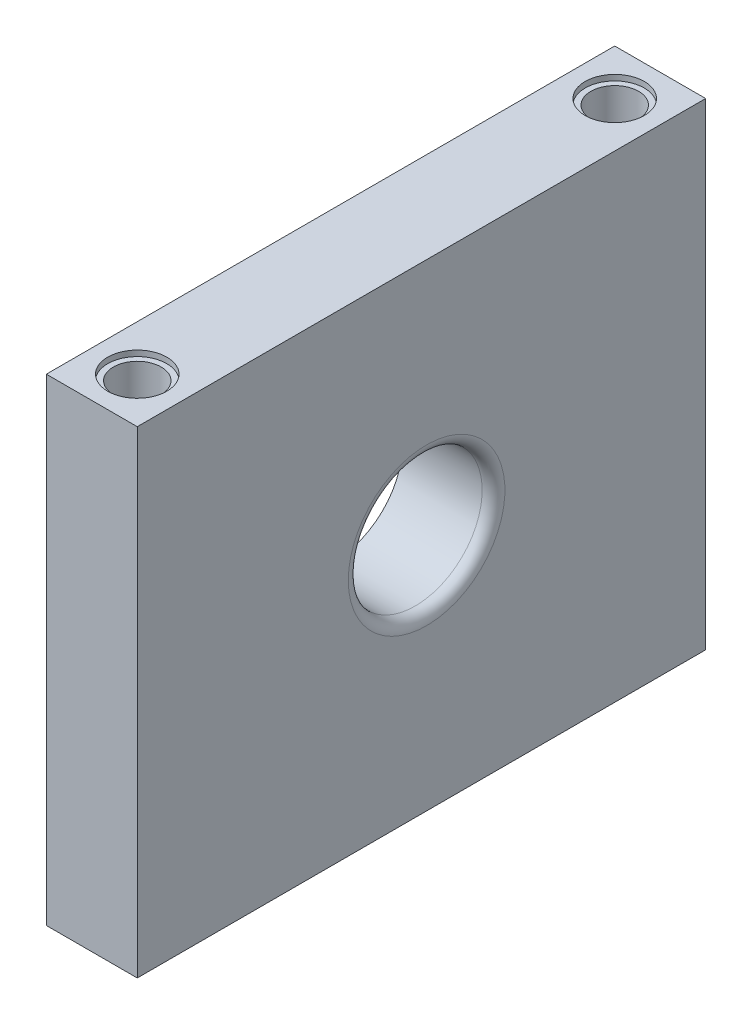
from build123d import *

# Parameters (mm, degrees)
SKETCH1_W           = 25
SKETCH1_H           = 50
SKETCH1_R           = 3.4
BOSS_EXTRUDE1_DEPTH = 3
SKETCH2_W           = 50
SKETCH2_H           = 3
BOSS_EXTRUDE2_DEPTH = 8
SKETCH3_W           = 8
SKETCH3_H           = 50
BOSS_EXTRUDE3_DEPTH = 42
SKETCH4_R           = 2.65
CUT_EXTRUDE1_DEPTH  = 0.5
SKETCH5_R           = 5.888972746
CUT_EXTRUDE2_DEPTH  = 9
FILLET2_R           = 1
SKETCH6_R           = 12.6
BOSS_EXTRUDE4_DEPTH = 2
FILLET4_R           = 1
SKETCH8_R           = 1.589780168
SKETCH8_R_2         = 1.777428262
CUT_EXTRUDE3_DEPTH  = 10
SKETCH9_W           = 49.021678163
SKETCH9_H           = 20.976854622
CUT_EXTRUDE4_DEPTH  = 68.79439129
SKETCH11_R          = 2.1
CUT_EXTRUDE5_DEPTH  = 59.480168703
SKETCH14_R          = 2.6
CUT_EXTRUDE6_DEPTH  = 0.5


with BuildPart() as part:
    # Sketch1 → Boss-Extrude1 (new body)
    with BuildSketch(Plane(origin=(0, 0, 0), x_dir=(1, 0, 0), z_dir=(0, 1, 0))):
        with Locations((2.276951673, 11.384758364)):
            Rectangle(SKETCH1_W, SKETCH1_H)
        with Locations(Location((1.276951673, 11.384758364, 0), (0, 0, 270))):
            Circle(SKETCH1_R, mode=Mode.SUBTRACT)
    extrude(amount=BOSS_EXTRUDE1_DEPTH)

    # Sketch2 → Boss-Extrude2 (add)
    with BuildSketch(Plane.ZY.offset(10.223048327)):
        with Locations((-11.384758364, 1.5)):
            Rectangle(SKETCH2_W, SKETCH2_H)
    extrude(amount=BOSS_EXTRUDE2_DEPTH)

    # Sketch3 → Boss-Extrude3 (add)
    with BuildSketch(Plane.XZ):
        with Locations((-14.223048327, -11.384758364)):
            Rectangle(SKETCH3_W, SKETCH3_H)
    extrude(amount=BOSS_EXTRUDE3_DEPTH)

    # Sketch4 → Cut-Extrude1 (cut)
    with BuildSketch(Plane(origin=(0, 3, 0), x_dir=(1, 0, 0), z_dir=(0, 1, 0))):
        with Locations(Location((-14.223048327, 32.384758364, 0), (0, 0, 270))):
            Circle(SKETCH4_R)
        with Locations(Location((-14.223048327, -9.615241636, 0), (0, 0, 270))):
            Circle(SKETCH4_R)
    cut_extrude1 = extrude(amount=-CUT_EXTRUDE1_DEPTH, mode=Mode.SUBTRACT)

    # Mirror1: Cut-Extrude1 across plane
    add(cut_extrude1.mirror(Plane.ZX.offset(-19.5)), mode=Mode.SUBTRACT)

    # Sketch5 → Cut-Extrude2 (cut)
    with BuildSketch(Plane.ZY.offset(18.223048327)):
        with Locations((-11.836279124, -21)):
            Circle(SKETCH5_R)
    extrude(amount=-CUT_EXTRUDE2_DEPTH, mode=Mode.SUBTRACT)

    # Fillet2
    fillet2_edges = [part.edges().sort_by_distance(p)[0] for p in [
        (-10.223048327, -21, -17.72525187),
    ]]
    fillet(fillet2_edges, radius=FILLET2_R)

    # Mirror2: Cut-Extrude1 across plane
    add(cut_extrude1.mirror(Plane.ZY.offset(1.723048327)), mode=Mode.SUBTRACT)

    # Sketch6 → Boss-Extrude4 (add)
    with BuildSketch(Plane(origin=(0, 3, 0), x_dir=(1, 0, 0), z_dir=(0, 1, 0))):
        with BuildLine():
            Line((14.776951673, 5.825082115), (14.776951673, 16.944434614))
            ThreePointArc((14.776951673, 16.944434614), (-13.323048327, 11.384758364), (14.776951673, 5.825082115))
        make_face()
        with Locations(Location((1.276951673, 11.384758364, 0), (0, 0, 270))):
            Circle(SKETCH6_R, mode=Mode.SUBTRACT)
    extrude(amount=BOSS_EXTRUDE4_DEPTH)

    # Fillet4
    # the kernel refuses this fillet: 1 mm, written as the material it takes off along each edge
    with BuildSketch(Plane(origin=(14.776951673, 5, -3.325082115), x_dir=(0, -1, 0), z_dir=(0, 0, -1))) as fillet4_piece_1:
        with BuildLine():
            CenterArc((FILLET4_R, FILLET4_R), FILLET4_R, 180, 90)
            Line((0, FILLET4_R), (0, 0))
            Line((0, 0), (FILLET4_R, 0))
        make_face()
    extrude(amount=16.119352499, mode=Mode.SUBTRACT)

    # Sketch8 → Cut-Extrude3 (cut)
    with BuildSketch(Plane(origin=(0, 3, 0), x_dir=(1, 0, 0), z_dir=(0, 1, 0))):
        with Locations(Location((1.276951673, 19.884758364, 0), (0, 0, 270))):
            Circle(SKETCH8_R)
        with Locations(Location((1.276951673, 2.884758364, 0), (0, 0, 270))):
            Circle(SKETCH8_R_2)
    extrude(amount=-CUT_EXTRUDE3_DEPTH, mode=Mode.SUBTRACT)

    # Sketch9 → Cut-Extrude4 (cut, through all)
    with BuildSketch(Plane.XY.offset(13.615241636)):
        with Locations((-9.733887409, 10.488427311)):
            Rectangle(SKETCH9_W, SKETCH9_H)
    extrude(amount=-CUT_EXTRUDE4_DEPTH, mode=Mode.SUBTRACT)

    # Sketch11 → Cut-Extrude5 (cut, through all)
    with BuildSketch(Plane(origin=(0, 0, 0), x_dir=(1, 0, 0), z_dir=(0, 1, 0))):
        with Locations(Location((-14.223048327, 32.384758364, 0), (0, 0, 270))):
            Circle(SKETCH11_R)
    cut_extrude5 = extrude(amount=-CUT_EXTRUDE5_DEPTH, mode=Mode.SUBTRACT)

    # Mirror3: Cut-Extrude5 across plane
    add(cut_extrude5.mirror(Plane.XY.offset(-11.384758364)), mode=Mode.SUBTRACT)

    # Sketch14 → Cut-Extrude6 (cut)
    with BuildSketch(Plane(origin=(0, 0, 0), x_dir=(1, 0, 0), z_dir=(0, 1, 0))):
        with Locations(Location((-14.223048327, -9.615241636, 0), (0, 0, 270))):
            Circle(SKETCH14_R)
    cut_extrude6 = extrude(amount=-CUT_EXTRUDE6_DEPTH, mode=Mode.SUBTRACT)

    # Mirror4: Cut-Extrude6 across plane
    add(cut_extrude6.mirror(Plane.XY.offset(-11.384758364)), mode=Mode.SUBTRACT)


solid = part.part
